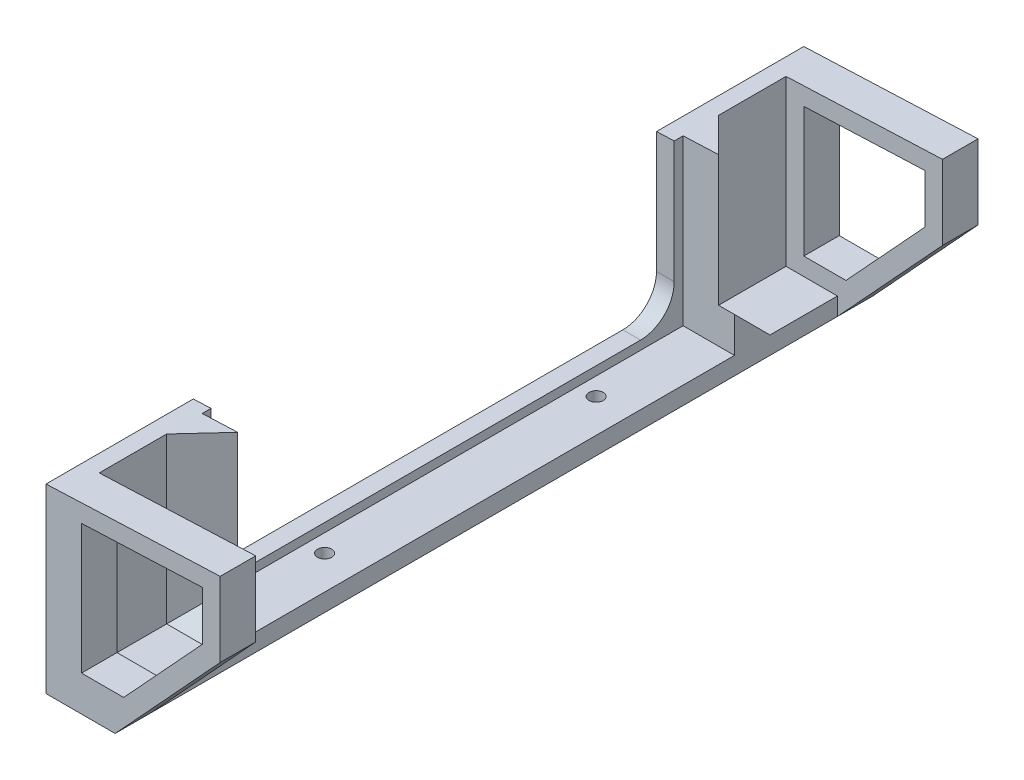
from build123d import *

# Parameters (mm, degrees)
BOSS_EXTRUDE1_DEPTH  = 10
BOSS_EXTRUDE6_DEPTH  = 41
CUT_EXTRUDE1_REACH   = 81.124
CUT_EXTRUDE2_REACH   = 81.124
BOSS_EXTRUDE9_DEPTH  = 10
CHAMFER3_SIZE        = 10
BOSS_EXTRUDE10_DEPTH = 55.75
CUT_EXTRUDE3_REACH   = 118.716
SKETCH12_R           = 2


with BuildPart() as part:
    # Sketch2 → Boss-Extrude1 (new body)
    with BuildSketch(Plane.XY):
        Polygon((-5, -51.344559606), (-5, -0.20517252), (44.083730464, 1.808954014), (44.083730464, -19.205040291), (14.477900916, -51.344559606), align=None)
    extrude(amount=BOSS_EXTRUDE1_DEPTH)

    # Sketch2<5> → Boss-Extrude6 (add)
    with BuildSketch(Plane.XY):
        Polygon((-5, -51.344559606), (14.477900916, -51.344559606), (14.477900916, -46.344559606), (0, -46.344559606), (0, 0), (-5, -0.20517252), align=None)
    extrude(amount=-BOSS_EXTRUDE6_DEPTH)

    # Sketch6 → Cut-Extrude1 (cut, up to next)
    with BuildSketch(Plane(origin=(0, 0, 0), x_dir=(0, 0, -1), z_dir=(1, 0, 0)), mode=Mode.PRIVATE) as cut_extrude1_sk1:
        with BuildLine():
            Line((31.5, 0), (41, 0))
            Line((41, 0), (41, -24.844559606))
            ThreePointArc((41, -24.844559606), (47.717514421, -41.062074027), (31.5, -34.344559606))
            Line((31.5, -34.344559606), (31.5, 0))
        make_face()
    cut_extrude1_tool1 = extrude(cut_extrude1_sk1.sketch, amount=-CUT_EXTRUDE1_REACH, mode=Mode.PRIVATE) & part.part
    add(cut_extrude1_tool1.solids().sort_by_distance((0, -24.478408, -38.654556))[0], mode=Mode.SUBTRACT)

    # Sketch7 → Cut-Extrude2 (cut, up to next)
    with BuildSketch(Plane(origin=(0, 0, 0), x_dir=(-1, 0, 0), z_dir=(0, 0, -1)), mode=Mode.PRIVATE) as cut_extrude2_sk1:
        Polygon((-39.083730464, -17.253097249), (-16.891496625, -41.344559606), (-5, -41.344559606), (-5, -4.799035286), (-39.083730464, -3.400426311), align=None)
    cut_extrude2_tool1 = extrude(cut_extrude2_sk1.sketch, amount=-CUT_EXTRUDE2_REACH, mode=Mode.PRIVATE) & part.part
    add(cut_extrude2_tool1.solids().sort_by_distance((19.604261, -19.893914, 0))[0], mode=Mode.SUBTRACT)

    # Sketch10 → Boss-Extrude9 (add)
    with BuildSketch(Plane.XY.offset(-29)):
        Polygon((14.477900916, -46.344559606), (0, -46.344559606), (0, 0), (10, 0.41034504), (10, -36.344559606), (14.477900916, -36.344559606), align=None)
    extrude(amount=BOSS_EXTRUDE9_DEPTH)

    # Chamfer3
    chamfer3_edges = [part.edges().sort_by_distance(p)[0] for p in [
        (12.238950458, -36.344559606, -19),
        (10, -17.967107283, -19),
    ]]
    chamfer(chamfer3_edges, length=CHAMFER3_SIZE - 0.0001)  # a hair under: the kernel refuses the full size

    # Sketch11 → Boss-Extrude10 (add)
    with BuildSketch(Plane(origin=(0, 0, -41), x_dir=(-1, 0, 0), z_dir=(0, 0, -1))):
        Polygon((5, -51.344559606), (5, -43.844559606), (0, -43.844559606), (0, -46.344559606), (-14.477900916, -46.344559606), (-14.477900916, -51.344559606), align=None)
    extrude(amount=BOSS_EXTRUDE10_DEPTH)

    # Sketch12 → Cut-Extrude3 (cut, up to next)
    with BuildSketch(Plane(origin=(0, -46.344559606, 0), x_dir=(1, 0, 0), z_dir=(0, 1, 0)), mode=Mode.PRIVATE) as cut_extrude3_sk1:
        with Locations(Location((5, 58.5, 0), (0, 0, 180))):
            Circle(SKETCH12_R)
    cut_extrude3_tool1 = extrude(cut_extrude3_sk1.sketch, amount=-CUT_EXTRUDE3_REACH, mode=Mode.PRIVATE) & part.part
    add(cut_extrude3_tool1.solids().sort_by_distance((5, -46.34456, -58.5))[0], mode=Mode.SUBTRACT)

    # Mirror3: part across plane


with BuildPart() as part_1:
    add(part.part)
    add(part.part.mirror(Plane(origin=(0, 0, -96.75), x_dir=(1, 0, 0), z_dir=(0, 0, -1))))


solid = part_1.part
